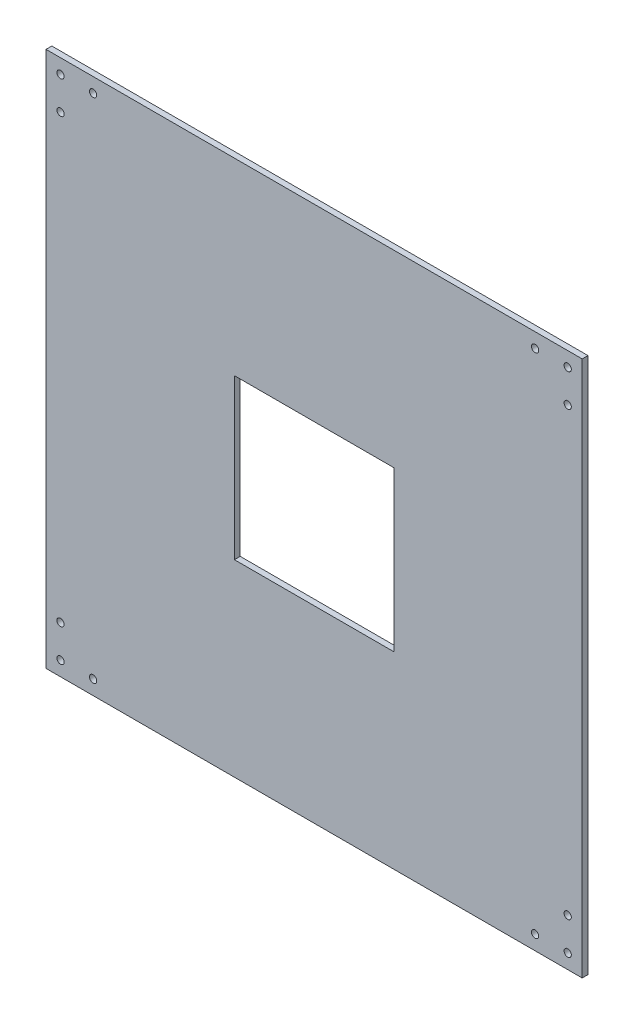
from build123d import *

# Parameters (mm, degrees)
SKETCH_1_W          = 370
SKETCH_1_H          = 370
EXTRUDE_1_DEPTH     = 4
SKETCH_2_R          = 2.5
CUT_EXTRUDE_1_DEPTH = 262.660084843
SKETCH_3_W          = 110
SKETCH_3_H          = 110
CUT_EXTRUDE_2_DEPTH = 10


with BuildPart() as part:
    # 草图1 → 凸台-拉伸1 (new body)
    with BuildSketch(Plane.XY):
        Rectangle(SKETCH_1_W, SKETCH_1_H)
    extrude(amount=EXTRUDE_1_DEPTH)

    # 草图2 → 切除-拉伸1 (cut, through all)
    with BuildSketch(Plane.XY.offset(4)):
        with Locations((-175, -175)):
            Circle(SKETCH_2_R)
        with Locations((-152.5, -175)):
            Circle(SKETCH_2_R)
        with Locations((-175, -152.5)):
            Circle(SKETCH_2_R)
        with Locations((-152.5, 175)):
            Circle(SKETCH_2_R)
        with Locations((-175, 152.5)):
            Circle(SKETCH_2_R)
        with Locations((-175, 175)):
            Circle(SKETCH_2_R)
        with Locations((175, 152.5)):
            Circle(SKETCH_2_R)
        with Locations((152.5, 175)):
            Circle(SKETCH_2_R)
        with Locations((175, 175)):
            Circle(SKETCH_2_R)
        with Locations((152.5, -175)):
            Circle(SKETCH_2_R)
        with Locations((175, -152.5)):
            Circle(SKETCH_2_R)
        with Locations((175, -175)):
            Circle(SKETCH_2_R)
    extrude(amount=-CUT_EXTRUDE_1_DEPTH, mode=Mode.SUBTRACT)

    # 草图3 → 切除-拉伸2 (cut)
    with BuildSketch(Plane(origin=(0, 0, 0), x_dir=(-1, 0, 0), z_dir=(0, 0, -1))):
        Rectangle(SKETCH_3_W, SKETCH_3_H)
    extrude(amount=-CUT_EXTRUDE_2_DEPTH, mode=Mode.SUBTRACT)


solid = part.part
